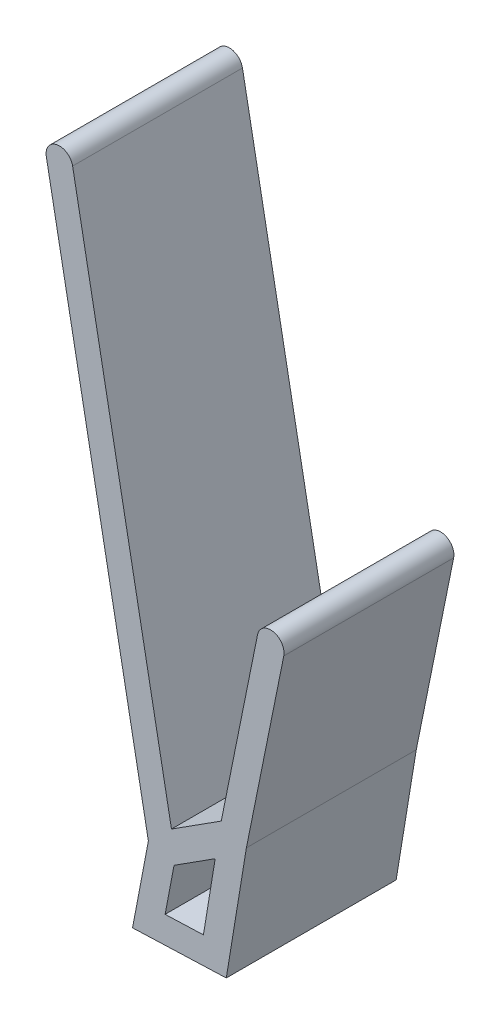
from build123d import *

# Parameters (mm, degrees)
BOSS_EXTRUDE1_DEPTH = 6.35


with BuildPart() as part:
    # Sketch1 → Boss-Extrude1 (new body)
    with BuildSketch(Plane.XY):
        with BuildLine():
            Line((7.438197612, 2.857423025), (6.846449104, -0.249288137))
            Line((6.846449104, -0.249288137), (10.350623211, -0.120795905))
            Line((10.350623211, -0.120795905), (11.102072552, 4.468031716))
            Line((11.102072552, 4.468031716), (12.499382227, 11.378887869))
            ThreePointArc((12.499382227, 11.378887869), (12.108389527, 11.968060772), (11.519216625, 11.577068073))
            Line((11.519216625, 11.577068073), (10.162125642, 4.865126731))
            Line((10.162125642, 4.865126731), (8.301461221, 3.676580149))
            Line((8.301461221, 3.676580149), (4.605997004, 23.291616705))
            ThreePointArc((4.605997004, 23.291616705), (4.022069932, 23.690401328), (3.62328531, 23.106474256))
            Line((3.62328531, 23.106474256), (7.438197612, 2.857423025))
        make_face()
        Polygon((8.397923208, 2.551591622), (8.063530531, 0.796012271), (9.496038689, 0.84853996), (9.935790343, 3.533943252), align=None, mode=Mode.SUBTRACT)
    extrude(amount=BOSS_EXTRUDE1_DEPTH)


solid = part.part
